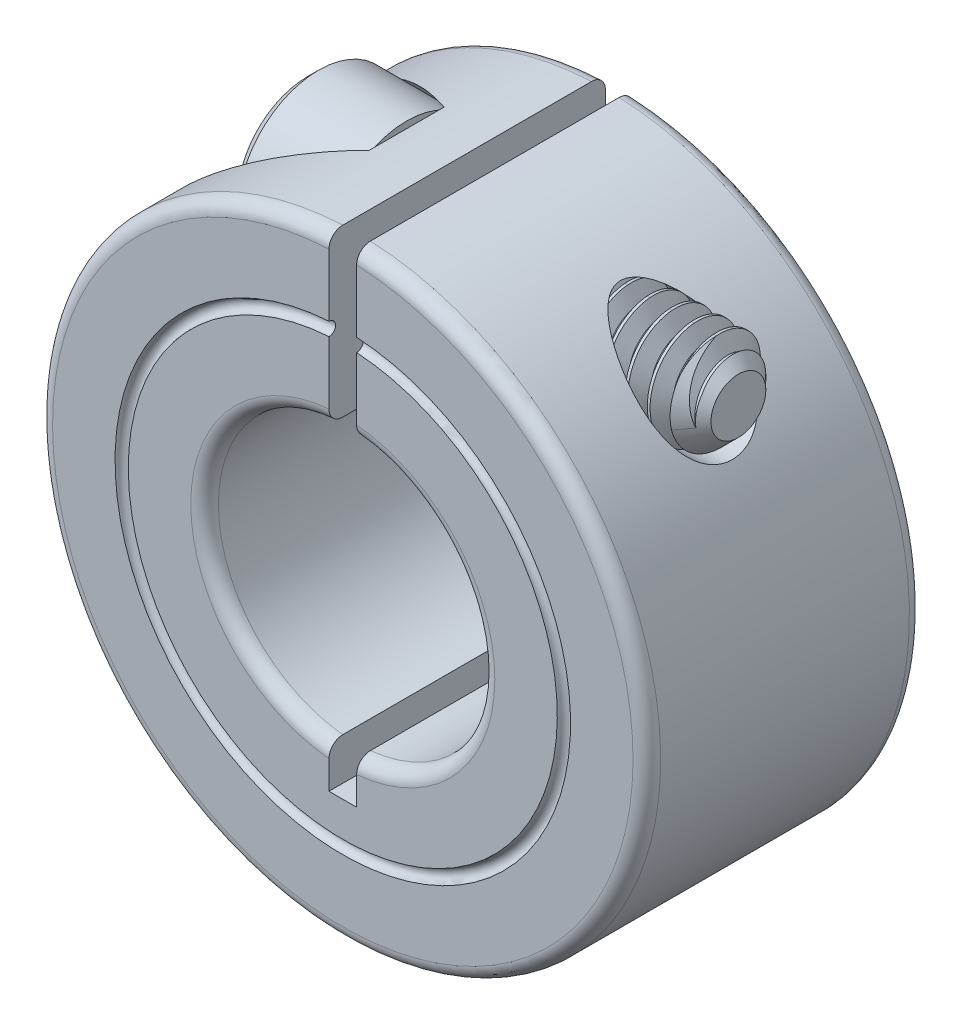
from build123d import *

# Parameters (mm, degrees)
EXTRUDE1_DEPTH     = 3.96875
FILLET1_R          = 0.396875
CUT_EXTRUDE1_DEPTH = 2.38125
CHAMFER1_SIZE      = 0.3175
CHAMFER2_SIZE      = 0.635
CUT_SWEEP1_PITCH   = 0.635


with BuildPart() as part:
    # Sketch1 → Extrude1 (new, symmetric)
    with BuildSketch(Plane.XY):
        with BuildLine():
            Line((-0.396875, 3.948856391), (-0.396875, 8.72222545))
            ThreePointArc((-0.396875, 8.72222545), (0, -8.73125), (0.396875, 8.72222545))
            Line((0.396875, 8.72222545), (0.396875, 3.948856391))
            ThreePointArc((0.396875, 3.948856391), (3.96875, 0), (0.396875, -3.948856391))
            Line((0.396875, -3.948856391), (0.396875, -5.159375))
            Line((0.396875, -5.159375), (-0.396875, -5.159375))
            Line((-0.396875, -5.159375), (-0.396875, -3.948856391))
            ThreePointArc((-0.396875, -3.948856391), (-3.96875, 0), (-0.396875, 3.948856391))
        make_face()
    extrude(amount=EXTRUDE1_DEPTH, both=True)

    # Fillet1
    fillet1_edges = [part.edges().sort_by_distance(p)[0] for p in [
        (-3.96875, 0, 3.96875),
        (0, -8.73125, 3.96875),
        (3.96875, 0, 3.96875),
        (3.96875, 0, -3.96875),
        (0, -8.73125, -3.96875),
        (-3.96875, 0, -3.96875),
    ]]
    fillet(fillet1_edges, radius=FILLET1_R)

    # Sketch2 → Cut-Revolve1 (revolve, cut)
    with BuildSketch(Plane(origin=(0, 0, 0), x_dir=(1, 0, 0), z_dir=(0, 1, 0))):
        with BuildLine():
            Line((-6.5405, -3.96875), (-6.1595, -3.96875))
            ThreePointArc((-6.1595, -3.96875), (-6.35, -3.77825), (-6.5405, -3.96875))
        make_face()
    revolve(axis=Axis((0, 0, -3.96875), (0, 0, 1)), mode=Mode.SUBTRACT)

    # Sketch3 → Cut-Revolve2 (revolve, cut)
    with BuildSketch(Plane.XY, mode=Mode.PRIVATE) as cut_revolve2_sk:
        Polygon((8.73125, 6.33554092), (-8.73125, 6.33554092), (-8.73125, 3.94794092), (-2.1336, 3.94794092), (-2.1336, 4.91314092), (8.73125, 4.91314092), align=None)
    revolve(cut_revolve2_sk.sketch.rotate(Axis((-8.73125, 6.33554092, 0), (-1, 0, 0)), 270), axis=Axis((-8.73125, 6.33554092, 0), (-1, 0, 0)), mode=Mode.SUBTRACT)


with BuildPart() as body_2:
    # Sketch4 → Revolve1 (revolve)
    with BuildSketch(Plane.XY):
        Polygon((-4.9784, 6.33554092), (-4.9784, 8.65964092), (-2.1336, 8.65964092), (-2.1336, 7.75794092), (7.3914, 7.75794092), (7.3914, 6.33554092), align=None)
    revolve(axis=Axis((7.3914, 6.33554092, 0), (-1, 0, 0)))

    # Sketch5 → Cut-Extrude1 (cut)
    with BuildSketch(Plane(origin=(-4.9784, 0, 0), x_dir=(0, -1, 0), z_dir=(-1, 0, 0))):
        Polygon((-5.648133256, -1.190625), (-4.960725592, 0), (-5.648133256, 1.190625), (-7.022948585, 1.190625), (-7.710356249, 0), (-7.022948585, -1.190625), align=None)
    extrude(amount=-CUT_EXTRUDE1_DEPTH, mode=Mode.SUBTRACT)

    # Chamfer1
    chamfer1_edges = [body_2.edges().sort_by_distance(p)[0] for p in [
        (-4.9784, 4.01144092, 0),
    ]]
    chamfer(chamfer1_edges, length=CHAMFER1_SIZE)

    # Chamfer2
    chamfer2_edges = [body_2.edges().sort_by_distance(p)[0] for p in [
        (7.3914, 4.91314092, 0),
    ]]
    chamfer(chamfer2_edges, length=CHAMFER2_SIZE)

    # Cut-Sweep1: arcs per turn and ends read off the stored shape
    # Cut-Sweep1: the profile of Sketch7 screwed along a right-hand helix through 15 turns, 6 arcs to a turn; built about Z, then put on its axis
    cut_sweep1_z = Axis((0, 0, 0), (0, 0, 1))
    cut_sweep1_corners = [(1.009955401, -1.76e-07, -0.396875018), (1.009955401, -1.76e-07, -0.476250018), (1.456770383, -2.54e-07, -0.734218768), (1.456770383, -2.54e-07, -0.138906268)]
    with BuildLine(mode=Mode.PRIVATE) as cut_sweep1_profile:
        Line(cut_sweep1_corners[0], cut_sweep1_corners[1])
        Line(cut_sweep1_corners[1], cut_sweep1_corners[2])
        Line(cut_sweep1_corners[2], cut_sweep1_corners[3])
        Line(cut_sweep1_corners[3], cut_sweep1_corners[0])
    cut_sweep1_cap = Face(cut_sweep1_profile.wire())
    cut_sweep1_turn_angles = [0, 30, 60, 90, 120, 150, 180, 210, 240, 270, 300, 330, 360]
    cut_sweep1_turn_weights = [1, 0.8660254037844387, 1, 0.8660254037844387, 1, 0.8660254037844387, 1, 0.8660254037844387, 1, 0.8660254037844387, 1, 0.8660254037844387, 1]
    cut_sweep1_turn_rails = [Edge.make_bspline([Vector(p[0], p[1], 0).rotate(cut_sweep1_z, cut_sweep1_turn_angles[k]) / cut_sweep1_turn_weights[k] + Vector(0, 0, p[2] + CUT_SWEEP1_PITCH * cut_sweep1_turn_angles[k] / 360) for k in range(13)], [0, 0, 0, 1, 1, 2, 2, 3, 3, 4, 4, 5, 5, 6, 6, 6], 2, cut_sweep1_turn_weights) for p in cut_sweep1_corners]
    cut_sweep1_turn_sides = [Face.make_surface_from_curves(cut_sweep1_turn_rails[p[0]], cut_sweep1_turn_rails[p[1]]) for p in [(0, 1), (1, 2), (2, 3), (3, 0)]]
    cut_sweep1 = Plane(origin=(7.3914, 6.33554092, 0), x_dir=(0, 0, 1), z_dir=(-1, 0, 0)) * Solid(Shell([*[p.moved(Location((0, 0, CUT_SWEEP1_PITCH * i))) for i in range(15) for p in cut_sweep1_turn_sides], cut_sweep1_cap, cut_sweep1_cap.rotate(cut_sweep1_z, 5400).moved(Location((0, 0, CUT_SWEEP1_PITCH * 5400 / 360)))]))
    add(cut_sweep1, mode=Mode.SUBTRACT)


solid = Compound([part.part, body_2.part])
